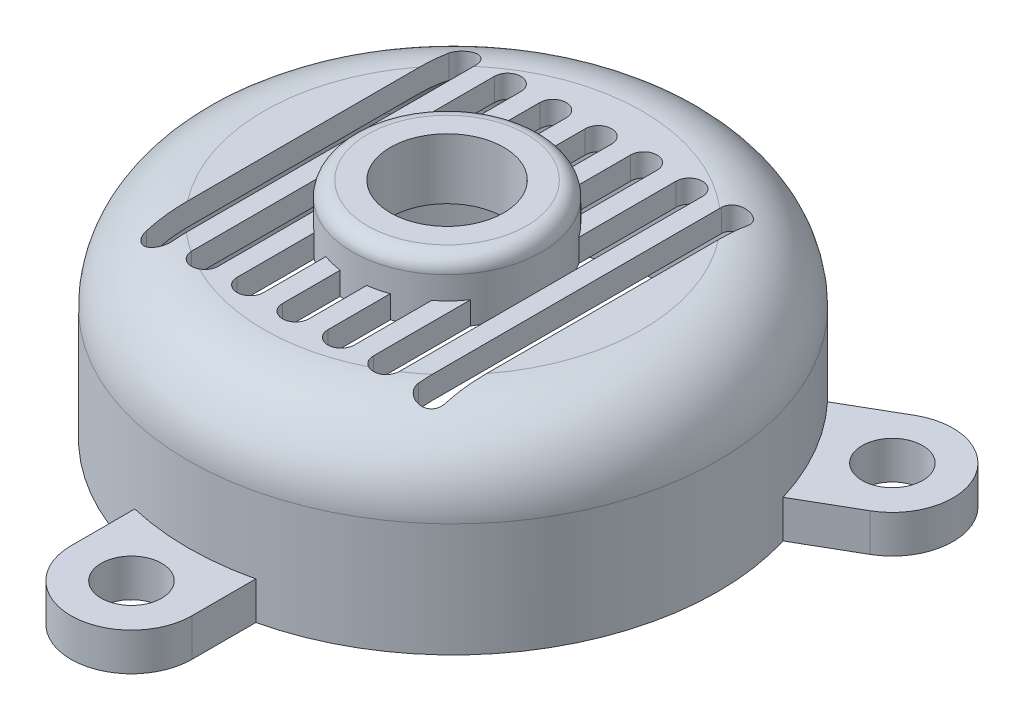
from build123d import *

# Parameters (mm, degrees)
SKETCH1_R           = 35
BOSS_EXTRUDE1_DEPTH = 25
FILLET1_R           = 10
SKETCH3_R           = 4
BOSS_EXTRUDE2_DEPTH = 5
CIRPATTERN1_COUNT   = 3
SHELL2_OUTLINE_R    = 32
SHELL2_DEPTH        = 14.9999999
SHELL2_2_DEPTH      = 2
CUT_EXTRUDE1_DEPTH  = 72.438444625
LPATTERN1_COUNT     = 7
LPATTERN1_PITCH     = 6
SKETCH8_R           = 12.5
BOSS_EXTRUDE3_DEPTH = 8
SKETCH9_R           = 7.5
CUT_EXTRUDE2_DEPTH  = 74.337925867
FILLET2_R           = 2


with BuildPart() as part:
    # Sketch1 → Boss-Extrude1 (new body)
    with BuildSketch(Plane(origin=(0, 0, 0), x_dir=(1, 0, 0), z_dir=(0, 1, 0))):
        with Locations(Location((0, 0.792187778, 0), (0, 0, 270))):
            Circle(SKETCH1_R)
    extrude(amount=BOSS_EXTRUDE1_DEPTH)

    # Fillet1
    fillet1_edges = [part.edges().sort_by_distance(p)[0] for p in [
        (0, 25, -35.792187778),
    ]]
    fillet(fillet1_edges, radius=FILLET1_R)

    # Sketch3 → Boss-Extrude2 (add)
    with BuildSketch(Plane.XZ):
        with BuildLine():
            Line((-8, 41.707812222), (-8, 33.281262297))
            ThreePointArc((-8, 33.281262297), (0, 34.207812222), (8, 33.281262297))
            Line((8, 33.281262297), (8, 41.707812222))
            ThreePointArc((8, 41.707812222), (0, 49.707812222), (-8, 41.707812222))
        make_face()
        with Locations(Location((0, 41.707812222, 0), (0, 0, 270))):
            Circle(SKETCH3_R, mode=Mode.SUBTRACT)
    boss_extrude2 = extrude(amount=-BOSS_EXTRUDE2_DEPTH)

    # CirPattern1: Boss-Extrude2 ×3 about axis
    cirpattern1_axis = Axis((0, 0, -0.792187778), (0, 1, 0))
    for i in range(1, CIRPATTERN1_COUNT):
        add(boss_extrude2.rotate(cirpattern1_axis, i * 360 / CIRPATTERN1_COUNT))

    # Shell2: read off the stored shape, not the designer's step
    # Shell2 outline → Shell2 (cut)
    with BuildSketch(Plane(origin=(0, 0, 0), x_dir=(1, 0, 0), z_dir=(0, 1, 0))):
        with Locations((0, 0.792187778)):
            Circle(SHELL2_OUTLINE_R)
    extrude(amount=SHELL2_DEPTH, mode=Mode.SUBTRACT)

    # Shell2 2 outline → Shell2 2 (cut)
    with BuildSketch(Plane(origin=(0, 0, 0), x_dir=(1, 0, 0), z_dir=(0, 1, 0))):
        with BuildLine():
            ThreePointArc((24.872431386, 20.925795426), (27.712812921, 16.792187778), (29.872431386, 12.265541388))
            Line((29.872431386, 12.265541388), (35.063438974, 15.262571016))
            ThreePointArc((35.063438974, 15.262571016), (30.743901834, 18.542187778), (30.063438974, 23.922825054))
            Line((30.063438974, 23.922825054), (24.872431386, 20.925795426))
        make_face()
        with BuildLine():
            Line((5, -36.808832737), (5, -30.814773481))
            ThreePointArc((5, -30.814773481), (0, -31.207812222), (-5, -30.814773481))
            Line((-5, -30.814773481), (-5, -36.808832737))
            ThreePointArc((-5, -36.808832737), (0, -34.707812222), (5, -36.808832737))
        make_face()
        with BuildLine():
            ThreePointArc((-29.872431386, 12.265541388), (-27.712812921, 16.792187778), (-24.872431386, 20.925795426))
            Line((-24.872431386, 20.925795426), (-30.063438974, 23.922825054))
            ThreePointArc((-30.063438974, 23.922825054), (-30.743901834, 18.542187778), (-35.063438974, 15.262571016))
            Line((-35.063438974, 15.262571016), (-29.872431386, 12.265541388))
        make_face()
    extrude(amount=SHELL2_2_DEPTH, mode=Mode.SUBTRACT)

    # Shell2 3 outline → Shell2 3 (revolve, cut)
    with BuildSketch(Plane.XY.offset(-0.792187778)):
        with BuildLine():
            Line((25, 22), (0, 22))
            Line((0, 22), (0, 14.9999999))
            Line((0, 14.9999999), (32, 15))
            ThreePointArc((32, 15), (29.949747468, 19.949747468), (25, 22))
        make_face()
    revolve(axis=Axis((0, 0, -0.792187778), (0, 1, 0)), mode=Mode.SUBTRACT)

    # Sketch6 → Cut-Extrude1 (cut, through all)
    with BuildSketch(Plane(origin=(0, 25, 0), x_dir=(1, 0, 0), z_dir=(0, 1, 0))):
        with BuildLine():
            Line((16.25, -20), (16.25, 20))
            ThreePointArc((16.25, 20), (18, 21.75), (19.75, 20))
            Line((19.75, 20), (19.75, -20))
            ThreePointArc((19.75, -20), (18, -21.75), (16.25, -20))
        make_face()
    cut_extrude1 = extrude(amount=-CUT_EXTRUDE1_DEPTH, mode=Mode.SUBTRACT)

    # LPattern1: Cut-Extrude1 ×7
    with Locations(*[(-i * LPATTERN1_PITCH, 0, 0) for i in range(1, LPATTERN1_COUNT)]):
        add(cut_extrude1, mode=Mode.SUBTRACT)

    # Sketch8 → Boss-Extrude3 (add)
    with BuildSketch(Plane(origin=(0, 22, 0), x_dir=(1, 0, 0), z_dir=(0, 1, 0))):
        with Locations(Location((0, 0, 0), (0, 0, 81.952153753))):
            Circle(SKETCH8_R)
    extrude(amount=BOSS_EXTRUDE3_DEPTH)

    # Sketch9 → Cut-Extrude2 (cut, through all)
    with BuildSketch(Plane(origin=(0, 30, 0), x_dir=(1, 0, 0), z_dir=(0, 1, 0))):
        with Locations(Location((0, 0, 0), (0, 0, 270))):
            Circle(SKETCH9_R)
    extrude(amount=-CUT_EXTRUDE2_DEPTH, mode=Mode.SUBTRACT)

    # Fillet2
    fillet2_edges = [part.edges().sort_by_distance(p)[0] for p in [
        (-1.75, 30, 12.376893794),
    ]]
    fillet(fillet2_edges, radius=FILLET2_R)


solid = part.part
